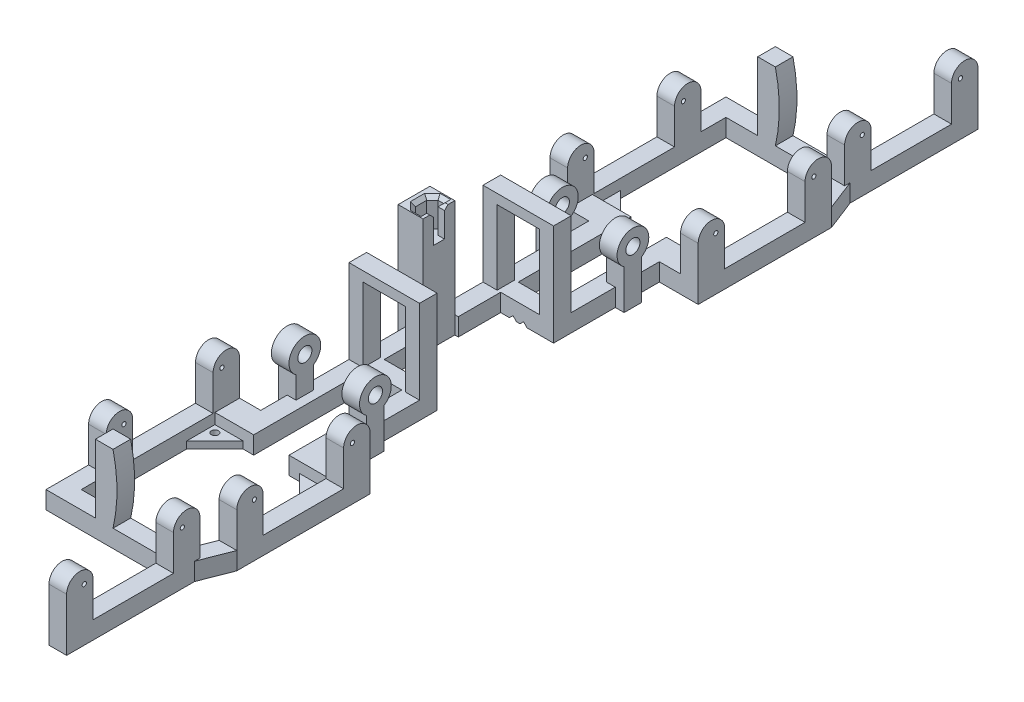
from build123d import *

# Parameters (mm, degrees)
SKETCH_2_5_W               = 5
SKETCH_2_5_H               = 5
RAIL1_DEPTH                = 27.5
ARCHFORTHREAD1_DEPTH       = 2.5
RAIL2_DEPTH                = 2.5
SKETCH_3_W                 = 5
SKETCH_3_H                 = 5
CELLNEST_DEPTH             = 14.5
SKETCH_4_W                 = 7.05
SKETCH_4_H                 = 9
EXTRUDE_6_DEPTH            = 25
EXTRUDE_7_DEPTH            = 8
CHAMFER_1_SIZE             = 1
SKETCH_7_R                 = 2
EXTRUDE_8_DEPTH            = 2.5
SKETCH_12_W                = 16
SKETCH_12_H                = 7
EXTRUDE_9_DEPTH            = 5
SKETCH_13_R                = 0.6
EXTRUDE_10_DEPTH           = 5
EXTRUDE_11_DEPTH           = 5
PATTERN_LINEAR_1_COUNT     = 2
PATTERN_LINEAR_1_PITCH     = 45
EXTRUDE_12_DEPTH           = 5
EXTRUDE_13_DEPTH           = 5
MIRROR_13_COPY_1_DEPTH     = 2.5
MIRROR_13_COPY_2_DEPTH     = 2.5
MIRROR_21_COPY_1_SKETCH_W  = 5
MIRROR_21_COPY_1_SKETCH_H  = 5
MIRROR_21_COPY_1_DEPTH     = 27.5
MIRROR_21_COPY_2_SKETCH_W  = 5
MIRROR_21_COPY_2_SKETCH_H  = 5
MIRROR_21_COPY_2_DEPTH     = 27.5
MIRROR_21_COPY_3_DEPTH     = 2.5
MIRROR_21_COPY_4_DEPTH     = 2.5
MIRROR_22_COPY_1_SKETCH_R  = 2
MIRROR_22_COPY_1_DEPTH     = 2.5
MIRROR_22_COPY_2_SKETCH_R  = 2
MIRROR_22_COPY_2_DEPTH     = 2.5
MIRROR_23_COPY_1_SKETCH_W  = 16
MIRROR_23_COPY_1_SKETCH_H  = 7
MIRROR_23_COPY_1_DEPTH     = 5
MIRROR_23_COPY_2_SKETCH_R  = 0.6
MIRROR_23_COPY_2_DEPTH     = 5
MIRROR_23_COPY_3_SKETCH_W  = 16
MIRROR_23_COPY_3_SKETCH_H  = 7
MIRROR_23_COPY_3_DEPTH     = 5
MIRROR_23_COPY_4_SKETCH_R  = 0.6
MIRROR_23_COPY_4_DEPTH     = 5
MIRROR_25_COPY_1_SKETCH_R  = 0.6
MIRROR_25_COPY_1_DEPTH     = 5
MIRROR_25_COPY_2_SKETCH_R  = 0.6
MIRROR_25_COPY_2_DEPTH     = 5
SKETCH_18_R                = 1
EXTRUDE_14_DEPTH           = 2
MIRROR_2_2_COPY_1_SKETCH_R = 1
MIRROR_2_2_COPY_1_DEPTH    = 2
MIRROR_2_2_COPY_2_SKETCH_R = 1
MIRROR_2_2_COPY_2_DEPTH    = 2
SKETCH1_W                  = 20
SKETCH1_H                  = 5.837148382
CUT_EXTRUDE1_DEPTH         = 10


with BuildPart() as part:
    # Эскиз2<5> → Rail1 (new body)
    with BuildSketch(Plane.XY):
        with Locations((7.5, 2.5)):
            Rectangle(SKETCH_2_5_W, SKETCH_2_5_H)
    rail1 = extrude(amount=-RAIL1_DEPTH)

    # Эскиз2 → ArchForThread1 (add, symmetric)
    with BuildSketch(Plane.XY):
        Polygon((0, 5), (0, 0), (0.5, 0), (1.5, 1), (2.5, 0), (5, 0), (5, 5), align=None)
        Polygon((6, 26), (6, 5), (10, 5), (10, 32), (2.5, 32), (1.5, 31), (0.5, 32), (0, 32), (0, 26), align=None)
    archforthread1 = extrude(amount=ARCHFORTHREAD1_DEPTH, both=True)

    # Mirror 2: ArchForThread1 across plane
    add(archforthread1.mirror(Plane(origin=(0, 0, 0), x_dir=(0, 0, 1), z_dir=(1, 0, 0))))

    # Зеркальное отражение3: Rail1 across plane
    add(rail1.mirror(Plane(origin=(0, 0, 0), x_dir=(0, 0, 1), z_dir=(1, 0, 0))))

    # Эскиз2<6> → Rail2 (add)
    with BuildSketch(Plane.XY):
        Polygon((6, 5), (5, 5), (5, 0), (10, 0), (10, 5), align=None)
    rail2 = extrude(amount=RAIL2_DEPTH)

    # Эскиз3 → CellNest (add)
    with BuildSketch(Plane.XY):
        with Locations((-7.5, 2.5)):
            Rectangle(SKETCH_3_W, SKETCH_3_H)
    cellnest = extrude(amount=CELLNEST_DEPTH)

    # Эскиз4 → Бобышка-Вытянуть6 (add)
    with BuildSketch(Plane(origin=(0, 0, 0), x_dir=(1, 0, 0), z_dir=(0, 1, 0))):
        with Locations((-9.525, -19)):
            Rectangle(SKETCH_4_W, SKETCH_4_H)
    extrude(amount=EXTRUDE_6_DEPTH)

    # Эскиз5 → Бобышка-Вытянуть7 (add)
    with BuildSketch(Plane(origin=(0, 25, 0), x_dir=(1, 0, 0), z_dir=(0, 1, 0))):
        Polygon((-13.05, -23.5), (-6, -23.5), (-6, -20.6), (-7.85, -20.6), (-7.85, -22.2), (-9.45, -22.2), (-11.05, -20.6), (-11.05, -17.4), (-9.45, -15.8), (-7.85, -15.8), (-7.85, -17.4), (-6, -17.4), (-6, -14.5), (-13.05, -14.5), align=None)
    extrude(amount=EXTRUDE_7_DEPTH)

    # Фаска1
    chamfer_1_edges = [part.edges().sort_by_distance(p)[0] for p in [
        (-6.925, 33, 20.6),
        (-7.85, 33, 21.4),
        (-8.65, 33, 22.2),
        (-10.25, 33, 21.4),
        (-6.925, 33, 17.4),
        (-7.85, 33, 16.6),
        (-8.65, 33, 15.8),
        (-10.25, 33, 16.6),
        (-11.05, 33, 19),
    ]]
    chamfer(chamfer_1_edges, length=CHAMFER_1_SIZE)

    # Эскиз7 → Бобышка-Вытянуть8 (add, symmetric)
    with BuildSketch(Plane(origin=(10, 0, 0), x_dir=(0, 0, -1), z_dir=(1, 0, 0))):
        with BuildLine():
            Line((20, 11.258342613), (20, 0))
            Line((20, 0), (15, 0))
            Line((15, 0), (15, 11.258342613))
            ThreePointArc((15, 11.258342613), (17.5, 19.5), (20, 11.258342613))
        make_face()
        with Locations((17.5, 15)):
            Circle(SKETCH_7_R, mode=Mode.SUBTRACT)
    extrude_8 = extrude(amount=EXTRUDE_8_DEPTH, both=True)

    # Зеркальное отражение4: Бобышка-Вытянуть8 across plane
    add(extrude_8.mirror(Plane(origin=(0, 0, 0), x_dir=(0, 0, 1), z_dir=(1, 0, 0))))

    # Эскиз12 → Бобышка-Вытянуть9 (add)
    with BuildSketch(Plane(origin=(0, 0, 0), x_dir=(1, 0, 0), z_dir=(0, 1, 0))):
        with Locations((13, 31)):
            Rectangle(SKETCH_12_W, SKETCH_12_H)
    extrude_9 = extrude(amount=EXTRUDE_9_DEPTH)

    # Эскиз13 → Бобышка-Вытянуть10 (add)
    with BuildSketch(Plane(origin=(21, 0, 0), x_dir=(0, 0, -1), z_dir=(1, 0, 0))):
        with BuildLine():
            Line((27.5, 0), (65.3, 0))
            Line((65.3, 0), (65.3, 15))
            ThreePointArc((65.3, 15), (61.55, 18.75), (57.8, 15))
            Line((57.8, 15), (57.8, 5))
            Line((57.8, 5), (35, 5))
            Line((35, 5), (35, 15))
            ThreePointArc((35, 15), (31.25, 18.75), (27.5, 15))
            Line((27.5, 15), (27.5, 0))
        make_face()
        with Locations((32.5, 15)):
            Circle(SKETCH_13_R, mode=Mode.SUBTRACT)
        with Locations((60.3, 15)):
            Circle(SKETCH_13_R, mode=Mode.SUBTRACT)
    extrude_10 = extrude(amount=-EXTRUDE_10_DEPTH)

    # Зеркальное отражение5: Бобышка-Вытянуть9, Бобышка-Вытянуть10 across plane
    add(extrude_9.mirror(Plane(origin=(0, 0, 0), x_dir=(0, 0, 1), z_dir=(1, 0, 0))))
    add(extrude_10.mirror(Plane(origin=(0, 0, 0), x_dir=(0, 0, 1), z_dir=(1, 0, 0))))

    # Эскиз14 → Бобышка-Вытянуть11 (add)
    with BuildSketch(Plane(origin=(0, 0, 0), x_dir=(1, 0, 0), z_dir=(0, 1, 0))):
        Polygon((21, 65.3), (17.5, 74.3), (12.5, 74.3), (16, 65.3), align=None)
    extrude_11 = extrude(amount=EXTRUDE_11_DEPTH)

    # Линейный массив1: Бобышка-Вытянуть10 ×2
    with Locations(*[Vector(-0.07457805825848672, 0, -0.9972151789991937) * (i * PATTERN_LINEAR_1_PITCH) for i in range(1, PATTERN_LINEAR_1_COUNT)]):
        add(extrude_10)

    # Эскиз15 → Бобышка-Вытянуть12 (add)
    with BuildSketch(Plane(origin=(0, 0, 0), x_dir=(1, 0, 0), z_dir=(0, 1, 0))):
        Polygon((13.248734368, 72.374683055), (-16, 72.374683055), (-16, 65.3), (-21.000237038, 65.3), (-21.000237038, 72.374683055), (-21.000237038, 77.374683055), (13.248734368, 77.374683055), align=None)
    extrude_12 = extrude(amount=EXTRUDE_12_DEPTH)

    # Эскиз16 → Бобышка-Вытянуть13 (add)
    with BuildSketch(Plane(origin=(0, 0, -77.374683055), x_dir=(-1, 0, 0), z_dir=(0, 0, -1))):
        with BuildLine():
            Line((7.000237038, 24.370480215), (2.000237038, 24.370480215))
            ThreePointArc((2.000237038, 24.370480215), (0.881288878, 14.685240107), (2.000237038, 5))
            Line((2.000237038, 5), (7.000237038, 5))
            Line((7.000237038, 5), (7.000237038, 24.370480215))
        make_face()
    extrude_13 = extrude(amount=-EXTRUDE_13_DEPTH)

    # Зеркальное отражение8: CellNest across plane
    add(cellnest.mirror(Plane.XY.offset(19)))

    # Зеркальное отражение13 copy 1 sketch → Зеркальное отражение13 copy 1 (add, symmetric)
    with BuildSketch(Plane(origin=(0, 0, 38), x_dir=(-1, 0, 0), z_dir=(0, 0, -1))):
        Polygon((0, 5), (0, 0), (0.5, 0), (1.5, 1), (2.5, 0), (5, 0), (5, 5), align=None)
        Polygon((6, 26), (6, 5), (10, 5), (10, 32), (2.5, 32), (1.5, 31), (0.5, 32), (0, 32), (0, 26), align=None)
    extrude(amount=MIRROR_13_COPY_1_DEPTH, both=True)

    # Зеркальное отражение13 copy 2 sketch → Зеркальное отражение13 copy 2 (add, symmetric)
    with BuildSketch(Plane(origin=(0, 0, 38), x_dir=(1, 0, 0), z_dir=(0, 0, -1))):
        Polygon((0, -5), (0, 0), (0.5, 0), (1.5, -1), (2.5, 0), (5, 0), (5, -5), align=None)
        Polygon((6, -26), (6, -5), (10, -5), (10, -32), (2.5, -32), (1.5, -31), (0.5, -32), (0, -32), (0, -26), align=None)
    extrude(amount=MIRROR_13_COPY_2_DEPTH, both=True)

    # Зеркальное отражение19: Rail1 across plane
    add(rail1.mirror(Plane.XY.offset(19)))

    # Зеркальное отражение20: Rail2 across plane
    add(rail2.mirror(Plane.XY.offset(19)))

    # Зеркальное отражение21 copy 1 sketch → Зеркальное отражение21 copy 1 (add)
    with BuildSketch(Plane(origin=(0, 0, 38), x_dir=(-1, 0, 0), z_dir=(0, 0, -1))):
        with Locations((7.5, 2.5)):
            Rectangle(MIRROR_21_COPY_1_SKETCH_W, MIRROR_21_COPY_1_SKETCH_H)
    extrude(amount=-MIRROR_21_COPY_1_DEPTH)

    # Зеркальное отражение21 copy 2 sketch → Зеркальное отражение21 copy 2 (add)
    with BuildSketch(Plane(origin=(0, 0, 0), x_dir=(-1, 0, 0), z_dir=(0, 0, 1))):
        with Locations((7.5, -2.5)):
            Rectangle(MIRROR_21_COPY_2_SKETCH_W, MIRROR_21_COPY_2_SKETCH_H)
    extrude(amount=-MIRROR_21_COPY_2_DEPTH)

    # Зеркальное отражение21 copy 3 sketch → Зеркальное отражение21 copy 3 (add)
    with BuildSketch(Plane(origin=(0, 0, 38), x_dir=(-1, 0, 0), z_dir=(0, 0, -1))):
        Polygon((6, 5), (5, 5), (5, 0), (10, 0), (10, 5), align=None)
    extrude(amount=MIRROR_21_COPY_3_DEPTH)

    # Зеркальное отражение21 copy 4 sketch → Зеркальное отражение21 copy 4 (add)
    with BuildSketch(Plane(origin=(0, 0, 0), x_dir=(-1, 0, 0), z_dir=(0, 0, 1))):
        Polygon((6, -5), (5, -5), (5, 0), (10, 0), (10, -5), align=None)
    extrude(amount=MIRROR_21_COPY_4_DEPTH)

    # Зеркальное отражение22 copy 1 sketch → Зеркальное отражение22 copy 1 (add, symmetric)
    with BuildSketch(Plane(origin=(-10, 0, 38), x_dir=(0, 0, 1), z_dir=(-1, 0, 0))):
        with BuildLine():
            Line((20, 11.258342613), (20, 0))
            Line((20, 0), (15, 0))
            Line((15, 0), (15, 11.258342613))
            ThreePointArc((15, 11.258342613), (17.5, 19.5), (20, 11.258342613))
        make_face()
        with Locations((17.5, 15)):
            Circle(MIRROR_22_COPY_1_SKETCH_R, mode=Mode.SUBTRACT)
    extrude(amount=MIRROR_22_COPY_1_DEPTH, both=True)

    # Зеркальное отражение22 copy 2 sketch → Зеркальное отражение22 copy 2 (add, symmetric)
    with BuildSketch(Plane(origin=(10, 0, 38), x_dir=(0, 0, 1), z_dir=(1, 0, 0))):
        with BuildLine():
            Line((20, -11.258342613), (20, 0))
            Line((20, 0), (15, 0))
            Line((15, 0), (15, -11.258342613))
            ThreePointArc((15, -11.258342613), (17.5, -19.5), (20, -11.258342613))
        make_face()
        with Locations((17.5, -15)):
            Circle(MIRROR_22_COPY_2_SKETCH_R, mode=Mode.SUBTRACT)
    extrude(amount=MIRROR_22_COPY_2_DEPTH, both=True)

    # Зеркальное отражение23 copy 1 sketch → Зеркальное отражение23 copy 1 (add)
    with BuildSketch(Plane(origin=(0, 0, 38), x_dir=(-1, 0, 0), z_dir=(0, 1, 0))):
        with Locations((13, 31)):
            Rectangle(MIRROR_23_COPY_1_SKETCH_W, MIRROR_23_COPY_1_SKETCH_H)
    extrude(amount=MIRROR_23_COPY_1_DEPTH)

    # Зеркальное отражение23 copy 2 sketch → Зеркальное отражение23 copy 2 (add)
    with BuildSketch(Plane(origin=(-21, 0, 38), x_dir=(0, 0, 1), z_dir=(-1, 0, 0))):
        with BuildLine():
            Line((27.5, 0), (65.3, 0))
            Line((65.3, 0), (65.3, 15))
            ThreePointArc((65.3, 15), (61.55, 18.75), (57.8, 15))
            Line((57.8, 15), (57.8, 5))
            Line((57.8, 5), (35, 5))
            Line((35, 5), (35, 15))
            ThreePointArc((35, 15), (31.25, 18.75), (27.5, 15))
            Line((27.5, 15), (27.5, 0))
        make_face()
        with Locations((32.5, 15)):
            Circle(MIRROR_23_COPY_2_SKETCH_R, mode=Mode.SUBTRACT)
        with Locations((60.3, 15)):
            Circle(MIRROR_23_COPY_2_SKETCH_R, mode=Mode.SUBTRACT)
    extrude(amount=-MIRROR_23_COPY_2_DEPTH)

    # Зеркальное отражение23 copy 3 sketch → Зеркальное отражение23 copy 3 (add)
    with BuildSketch(Plane(origin=(0, 0, 38), x_dir=(1, 0, 0), z_dir=(0, 1, 0))):
        with Locations((13, -31)):
            Rectangle(MIRROR_23_COPY_3_SKETCH_W, MIRROR_23_COPY_3_SKETCH_H)
    extrude(amount=MIRROR_23_COPY_3_DEPTH)

    # Зеркальное отражение23 copy 4 sketch → Зеркальное отражение23 copy 4 (add)
    with BuildSketch(Plane(origin=(21, 0, 38), x_dir=(0, 0, 1), z_dir=(1, 0, 0))):
        with BuildLine():
            Line((27.5, 0), (65.3, 0))
            Line((65.3, 0), (65.3, -15))
            ThreePointArc((65.3, -15), (61.55, -18.75), (57.8, -15))
            Line((57.8, -15), (57.8, -5))
            Line((57.8, -5), (35, -5))
            Line((35, -5), (35, -15))
            ThreePointArc((35, -15), (31.25, -18.75), (27.5, -15))
            Line((27.5, -15), (27.5, 0))
        make_face()
        with Locations((32.5, -15)):
            Circle(MIRROR_23_COPY_4_SKETCH_R, mode=Mode.SUBTRACT)
        with Locations((60.3, -15)):
            Circle(MIRROR_23_COPY_4_SKETCH_R, mode=Mode.SUBTRACT)
    extrude(amount=-MIRROR_23_COPY_4_DEPTH)

    # Зеркальное отражение24: Бобышка-Вытянуть11 across plane
    add(extrude_11.mirror(Plane.XY.offset(19)))

    # Зеркальное отражение25 copy 1 sketch → Зеркальное отражение25 copy 1 (add)
    with BuildSketch(Plane(origin=(17.643987378, 0, 82.874683055), x_dir=(0, 0, 1), z_dir=(1, 0, 0))):
        with BuildLine():
            Line((27.5, 0), (65.3, 0))
            Line((65.3, 0), (65.3, -15))
            ThreePointArc((65.3, -15), (61.55, -18.75), (57.8, -15))
            Line((57.8, -15), (57.8, -5))
            Line((57.8, -5), (35, -5))
            Line((35, -5), (35, -15))
            ThreePointArc((35, -15), (31.25, -18.75), (27.5, -15))
            Line((27.5, -15), (27.5, 0))
        make_face()
        with Locations((32.5, -15)):
            Circle(MIRROR_25_COPY_1_SKETCH_R, mode=Mode.SUBTRACT)
        with Locations((60.3, -15)):
            Circle(MIRROR_25_COPY_1_SKETCH_R, mode=Mode.SUBTRACT)
    extrude(amount=-MIRROR_25_COPY_1_DEPTH)

    # Зеркальное отражение25 copy 2 sketch → Зеркальное отражение25 copy 2 (add)
    with BuildSketch(Plane(origin=(21, 0, 38), x_dir=(0, 0, 1), z_dir=(1, 0, 0))):
        with BuildLine():
            Line((27.5, 0), (65.3, 0))
            Line((65.3, 0), (65.3, -15))
            ThreePointArc((65.3, -15), (61.55, -18.75), (57.8, -15))
            Line((57.8, -15), (57.8, -5))
            Line((57.8, -5), (35, -5))
            Line((35, -5), (35, -15))
            ThreePointArc((35, -15), (31.25, -18.75), (27.5, -15))
            Line((27.5, -15), (27.5, 0))
        make_face()
        with Locations((32.5, -15)):
            Circle(MIRROR_25_COPY_2_SKETCH_R, mode=Mode.SUBTRACT)
        with Locations((60.3, -15)):
            Circle(MIRROR_25_COPY_2_SKETCH_R, mode=Mode.SUBTRACT)
    extrude(amount=-MIRROR_25_COPY_2_DEPTH)

    # Зеркальное отражение26: Бобышка-Вытянуть12, Бобышка-Вытянуть13 across plane
    add(extrude_12.mirror(Plane.XY.offset(19)))
    add(extrude_13.mirror(Plane.XY.offset(19)))

    # Эскиз18 → Бобышка-Вытянуть14 (add)
    with BuildSketch(Plane(origin=(0, 0, 0), x_dir=(1, 0, 0), z_dir=(0, 1, 0))):
        Polygon((16, 34.5), (8, 34.5), (16, 42.5), align=None)
        with Locations((14, 36.5)):
            Circle(SKETCH_18_R, mode=Mode.SUBTRACT)
    extrude_14 = extrude(amount=EXTRUDE_14_DEPTH)

    # Mirror 5168: Бобышка-Вытянуть14 across plane
    add(extrude_14.mirror(Plane(origin=(0, 0, 0), x_dir=(0, 0, 1), z_dir=(1, 0, 0))))

    # Mirror 2 2 copy 1 sketch → Mirror 2 2 copy 1 (add)
    with BuildSketch(Plane(origin=(0, 0, 38), x_dir=(-1, 0, 0), z_dir=(0, 1, 0))):
        Polygon((16, 34.5), (8, 34.5), (16, 42.5), align=None)
        with Locations((14, 36.5)):
            Circle(MIRROR_2_2_COPY_1_SKETCH_R, mode=Mode.SUBTRACT)
    extrude(amount=MIRROR_2_2_COPY_1_DEPTH)

    # Mirror 2 2 copy 2 sketch → Mirror 2 2 copy 2 (add)
    with BuildSketch(Plane(origin=(0, 0, 38), x_dir=(1, 0, 0), z_dir=(0, 1, 0))):
        Polygon((16, -34.5), (8, -34.5), (16, -42.5), align=None)
        with Locations((14, -36.5)):
            Circle(MIRROR_2_2_COPY_2_SKETCH_R, mode=Mode.SUBTRACT)
    extrude(amount=MIRROR_2_2_COPY_2_DEPTH)

    # Sketch1 → Cut-Extrude1 (cut)
    with BuildSketch(Plane(origin=(0, 0, -2.5), x_dir=(-1, 0, 0), z_dir=(0, 0, -1))):
        with Locations((0, 31.694330195)):
            Rectangle(SKETCH1_W, SKETCH1_H)
    cut_extrude1 = extrude(amount=-CUT_EXTRUDE1_DEPTH, mode=Mode.SUBTRACT)

    # Mirror1: Cut-Extrude1 across plane
    add(cut_extrude1.mirror(Plane.XY.offset(19)), mode=Mode.SUBTRACT)


solid = part.part
